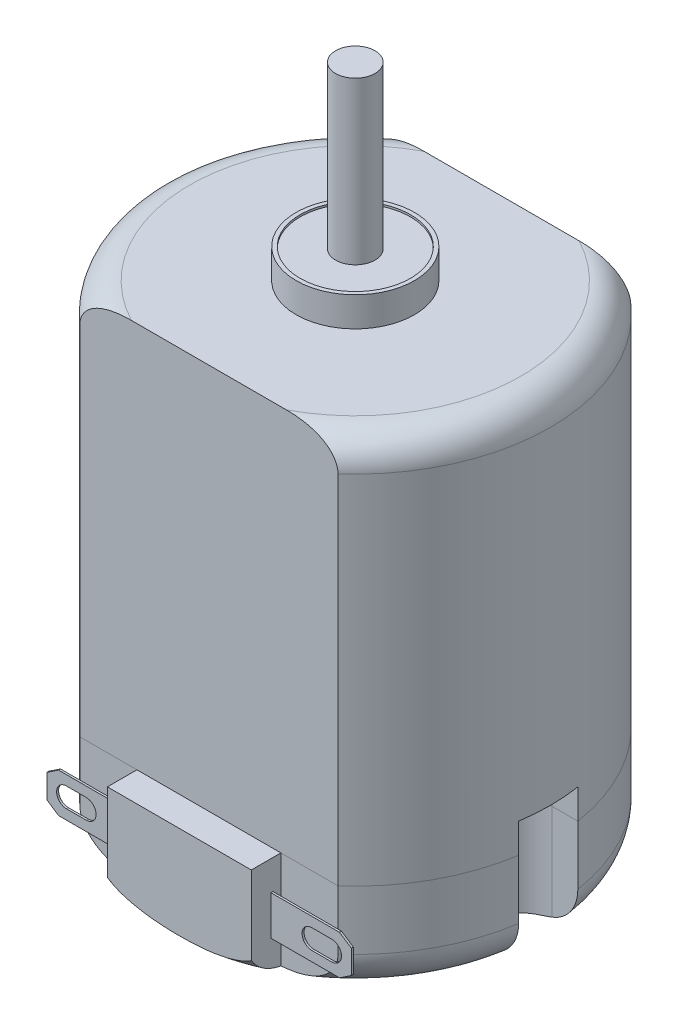
from build123d import *

# Parameters (mm, degrees)
BOSS_EXTRUDE1_DEPTH      = 19.6
BOSS_EXTRUDE2_DEPTH      = 5
SKETCH3_W                = 5.5
SKETCH3_H                = 0.9
BOSS_EXTRUDE3_DEPTH      = 2.3
SKETCH4_R                = 1
BOSS_EXTRUDE4_DEPTH      = 0.5
CUT_EXTRUDE1_DEPTH       = 6.5
BOSS_EXTRUDE5_DEPTH      = 7.725
BOSS_EXTRUDE5_DEPTH_BACK = 7.725
SKETCH7_W                = 0.1
SKETCH7_H                = 2
CUT_EXTRUDE2_DEPTH       = 0.1
SKETCH9_R                = 3
BOSS_EXTRUDE6_DEPTH      = 1.5
SKETCH10_R               = 2.8
CUT_EXTRUDE3_DEPTH       = 0.1
SKETCH11_R               = 1
BOSS_EXTRUDE7_DEPTH      = 8.2
FILLET2_R                = 1.5


with BuildPart() as part:
    # Sketch1 → Boss-Extrude1 (new body)
    with BuildSketch(Plane(origin=(0, 0, 0), x_dir=(1, 0, 0), z_dir=(0, 1, 0))):
        with BuildLine():
            Line((-6.548234495, 7.425), (6.548234495, 7.425))
            ThreePointArc((6.548234495, 7.425), (9.9, 0), (6.548234495, -7.425))
            Line((6.548234495, -7.425), (-6.548234495, -7.425))
            ThreePointArc((-6.548234495, -7.425), (-9.9, 0), (-6.548234495, 7.425))
        make_face()
    extrude(amount=BOSS_EXTRUDE1_DEPTH)


with BuildPart() as body_2:
    # Sketch2 → Boss-Extrude2 (new body)
    with BuildSketch(Plane.XZ):
        with BuildLine():
            Line((-6.548234495, -7.425), (6.548234495, -7.425))
            ThreePointArc((6.548234495, -7.425), (9.9, 0), (6.548234495, 7.425))
            Line((6.548234495, 7.425), (3.65, 7.425))
            Line((3.65, 7.425), (3.65, 8.925))
            Line((3.65, 8.925), (-3.65, 8.925))
            Line((-3.65, 8.925), (-3.65, 7.425))
            Line((-3.65, 7.425), (-6.548234495, 7.425))
            ThreePointArc((-6.548234495, 7.425), (-9.9, 0), (-6.548234495, -7.425))
        make_face()
    extrude(amount=BOSS_EXTRUDE2_DEPTH)

    # Sketch3 → Boss-Extrude3 (add)
    with BuildSketch(Plane.XZ.offset(5)):
        with BuildLine():
            Line((-2.865200691, -3.975), (2.865200691, -3.975))
            ThreePointArc((2.865200691, -3.975), (0, 4.9), (-2.865200691, -3.975))
        make_face()
        with Locations((0, 2.95)):
            Rectangle(SKETCH3_W, SKETCH3_H, mode=Mode.SUBTRACT)
    extrude(amount=BOSS_EXTRUDE3_DEPTH)

    # Sketch4 → Boss-Extrude4 (add)
    with BuildSketch(Plane.XZ.offset(7.3)):
        with Locations(Location((0, 0, 0), (0, 0, 270))):
            Circle(SKETCH4_R)
    extrude(amount=BOSS_EXTRUDE4_DEPTH)


with BuildPart() as cut_extrude1_tool:
    # Sketch5 → Cut-Extrude1 (new body)
    with BuildSketch(Plane.XZ.offset(5)):
        with BuildLine():
            ThreePointArc((-8.475, -1.5), (-6.975, 0), (-8.475, 1.5))
            Line((-8.475, 1.5), (-9.785703858, 1.5))
            ThreePointArc((-9.785703858, 1.5), (-9.9, 0), (-9.785703858, -1.5))
            Line((-9.785703858, -1.5), (-8.475, -1.5))
        make_face()
        with BuildLine():
            Line((9.785703858, 1.5), (8.475, 1.5))
            ThreePointArc((8.475, 1.5), (6.975, 0), (8.475, -1.5))
            Line((8.475, -1.5), (9.785703858, -1.5))
            ThreePointArc((9.785703858, -1.5), (9.9, 0), (9.785703858, 1.5))
        make_face()
    extrude(amount=-CUT_EXTRUDE1_DEPTH)


with BuildPart() as part_1:
    add(part.part)

    # Cut-Extrude1: cut by cut_extrude1_tool
    add(cut_extrude1_tool.part, mode=Mode.SUBTRACT)

    # Sketch9 → Boss-Extrude6 (add)
    with BuildSketch(Plane(origin=(0, 19.6, 0), x_dir=(1, 0, 0), z_dir=(0, 1, 0))):
        with Locations(Location((0, 0, 0), (0, 0, 270))):
            Circle(SKETCH9_R)
    extrude(amount=BOSS_EXTRUDE6_DEPTH)

    # Sketch10 → Cut-Extrude3 (cut)
    with BuildSketch(Plane(origin=(0, 21.1, 0), x_dir=(1, 0, 0), z_dir=(0, 1, 0))):
        with Locations(Location((0, 0, 0), (0, 0, 270))):
            Circle(SKETCH10_R)
    extrude(amount=-CUT_EXTRUDE3_DEPTH, mode=Mode.SUBTRACT)

    # Sketch11 → Boss-Extrude7 (add)
    with BuildSketch(Plane(origin=(0, 21, 0), x_dir=(1, 0, 0), z_dir=(0, 1, 0))):
        with Locations(Location((0, 0, 0), (0, 0, 90))):
            Circle(SKETCH11_R)
    extrude(amount=BOSS_EXTRUDE7_DEPTH)

    # Fillet2
    fillet2_edges = [part_1.edges().sort_by_distance(p)[0] for p in [
        (9.9, 19.6, 0),
        (-9.9, 19.6, 0),
    ]]
    fillet(fillet2_edges, radius=FILLET2_R)


with BuildPart() as body_2_1:
    add(body_2.part)

    # Cut-Extrude1: cut by cut_extrude1_tool
    add(cut_extrude1_tool.part, mode=Mode.SUBTRACT)

    # Fillet1: read off the stored shape, not the designer's step
    # Fillet1 outline → Fillet1 (revolve, cut)
    with BuildSketch(Plane.XY):
        with BuildLine():
            ThreePointArc((9.9, -3), (9.314213562, -4.414213562), (7.9, -5))
            Line((7.9, -5), (9.9, -5))
            Line((9.9, -5), (9.9, -3))
        make_face()
    revolve(axis=Axis((0, 0, 0), (0, 1, 0)), mode=Mode.SUBTRACT)

    # Sketch7 → Boss-Extrude5 (add, two sides: drawn at the far end of the back side and taken through both)
    with BuildSketch(Plane(origin=(0, 0, 0), x_dir=(0, 0, -1), z_dir=(1, 0, 0)).offset(-BOSS_EXTRUDE5_DEPTH_BACK)):
        with Locations((-7.875, -2.5)):
            Rectangle(SKETCH7_W, SKETCH7_H)
    extrude(amount=BOSS_EXTRUDE5_DEPTH + BOSS_EXTRUDE5_DEPTH_BACK)

    # Sketch8 → Cut-Extrude2 (cut)
    with BuildSketch(Plane.XY.offset(7.925)):
        with BuildLine():
            Line((6.725, -3), (5.725, -3))
            ThreePointArc((5.725, -3), (5.225, -2.5), (5.725, -2))
            Line((5.725, -2), (6.725, -2))
            ThreePointArc((6.725, -2), (7.225, -2.5), (6.725, -3))
        make_face()
        Polygon((7.725, -1.9), (7.125, -1.5), (7.725, -1.5), align=None)
        Polygon((7.725, -3.5), (7.725, -3.1), (7.125, -3.5), align=None)
        with BuildLine():
            Line((-6.725, -3), (-5.725, -3))
            ThreePointArc((-5.725, -3), (-5.225, -2.5), (-5.725, -2))
            Line((-5.725, -2), (-6.725, -2))
            ThreePointArc((-6.725, -2), (-7.225, -2.5), (-6.725, -3))
        make_face()
        Polygon((-7.725, -3.1), (-7.125, -3.5), (-7.725, -3.5), align=None)
        Polygon((-7.725, -1.5), (-7.725, -1.9), (-7.125, -1.5), align=None)
    extrude(amount=-CUT_EXTRUDE2_DEPTH, mode=Mode.SUBTRACT)


solid = Compound([part_1.part, body_2_1.part])
